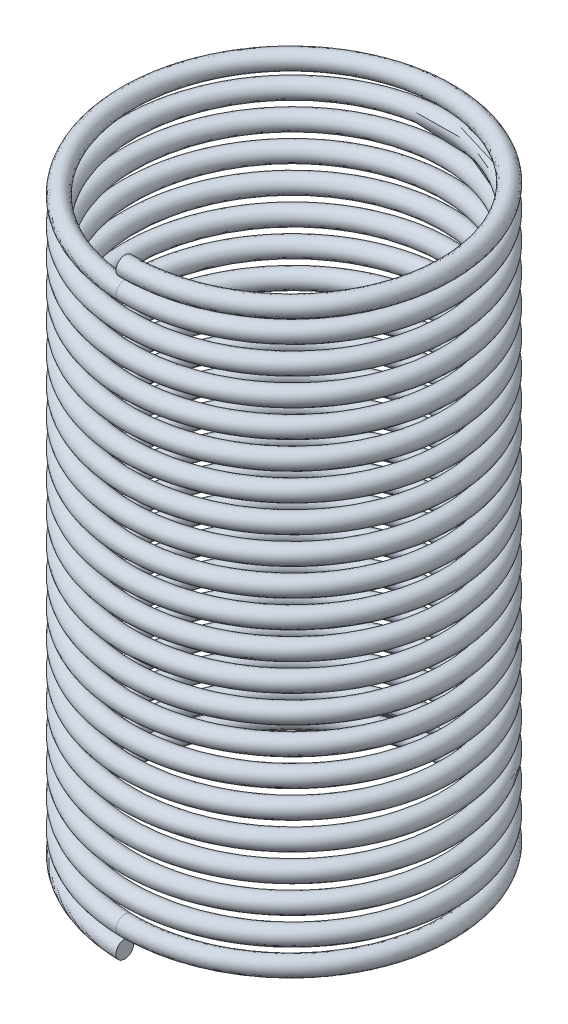
from build123d import *

# Parameters (mm, degrees)
SKETCH9_R = 0.25


with BuildPart() as part:
    # Sweep3: sweep along a curve in space
    with BuildLine() as sweep3_path:
        add(Edge.make_bspline(
            [(0, -0.6, 4.5), (-0.585272672, -0.587580128, 4.5), (-1.768623705, -0.562462812, 4.265693422), (-3.264360697, -0.525009964, 3.2648204), (-4.265816599, -0.48749733, 1.766908068), (-4.617120285, -0.450000715, 0), (-4.265702263, -0.412499808, -1.766908068), (-3.264818043, -0.375000051, -3.2648204), (-1.766908658, -0.337499987, -4.265693422), (0, -0.3, -4.617153289), (1.766908658, -0.262500013, -4.265693422), (3.264818043, -0.224999949, -3.2648204), (4.265702263, -0.187500192, -1.766908068), (4.617120285, -0.149999285, 0), (4.265816599, -0.11250267, 1.766908068), (3.264360697, -0.074990036, 3.2648204), (1.768623705, -0.037537188, 4.265693422), (0.585272672, -0.012419872, 4.5), (0, 0, 4.5)],
            knots=[0, 0, 0, 0, 0.0625, 0.125, 0.1875, 0.25, 0.3125, 0.375, 0.4375, 0.5, 0.5625, 0.625, 0.6875, 0.75, 0.8125, 0.875, 0.9375, 1, 1, 1, 1], degree=3))
        add(Edge.make_bspline(
            [(0, 0, 4.5), (-0.585273793, 0.015990616, 4.5), (-1.768623185, 0.048329115, 4.265693422), (-3.264360836, 0.096549675, 3.2648204), (-4.265816562, 0.144847187, 1.766908068), (-4.617120294, 0.193124079, 0), (-4.265702263, 0.241406497, -1.766908068), (-3.264818031, 0.289687434, -3.2648204), (-1.766908703, 0.337968768, -4.265693422), (1.7e-07, 0.386249995, -4.617153289), (1.766908023, 0.434531251, -4.265693422), (3.264820413, 0.4828125, -3.2648204), (4.265693419, 0.53109375, -1.766908068), (4.61715329, 0.579375, 0), (4.265693422, 0.62765625, 1.766908068), (3.2648204, 0.6759375, 3.2648204), (1.766908068, 0.72421875, 4.265693422), (0, 0.7725, 4.617153289), (-1.766908068, 0.82078125, 4.265693422), (-3.2648204, 0.8690625, 3.2648204), (-4.265693422, 0.91734375, 1.766908068), (-4.617153289, 0.965625, 0), (-4.265693422, 1.01390625, -1.766908068), (-3.2648204, 1.0621875, -3.2648204), (-1.766908068, 1.11046875, -4.265693422), (0, 1.15875, -4.617153289), (1.766908068, 1.20703125, -4.265693422), (3.2648204, 1.2553125, -3.2648204), (4.265693422, 1.30359375, -1.766908068), (4.617153289, 1.351875, 0), (4.265693422, 1.40015625, 1.766908068), (3.2648204, 1.4484375, 3.2648204), (1.766908068, 1.49671875, 4.265693422), (0, 1.545, 4.617153289), (-1.766908068, 1.59328125, 4.265693422), (-3.2648204, 1.6415625, 3.2648204), (-4.265693422, 1.68984375, 1.766908068), (-4.617153289, 1.738125, 0), (-4.265693422, 1.78640625, -1.766908068), (-3.2648204, 1.8346875, -3.2648204), (-1.766908068, 1.88296875, -4.265693422), (0, 1.93125, -4.617153289), (1.766908068, 1.97953125, -4.265693422), (3.2648204, 2.0278125, -3.2648204), (4.265693422, 2.07609375, -1.766908068), (4.617153289, 2.124375, 0), (4.265693422, 2.17265625, 1.766908068), (3.2648204, 2.2209375, 3.2648204), (1.766908068, 2.26921875, 4.265693422), (0, 2.3175, 4.617153289), (-1.766908068, 2.36578125, 4.265693422), (-3.2648204, 2.4140625, 3.2648204), (-4.265693422, 2.46234375, 1.766908068), (-4.617153289, 2.510625, 0), (-4.265693422, 2.55890625, -1.766908068), (-3.2648204, 2.6071875, -3.2648204), (-1.766908068, 2.65546875, -4.265693422), (0, 2.70375, -4.617153289), (1.766908068, 2.75203125, -4.265693422), (3.2648204, 2.8003125, -3.2648204), (4.265693422, 2.84859375, -1.766908068), (4.617153289, 2.896875, 0), (4.265693422, 2.94515625, 1.766908068), (3.2648204, 2.9934375, 3.2648204), (1.766908068, 3.04171875, 4.265693422), (0, 3.09, 4.617153289), (-1.766908068, 3.13828125, 4.265693422), (-3.2648204, 3.1865625, 3.2648204), (-4.265693422, 3.23484375, 1.766908068), (-4.617153289, 3.283125, 0), (-4.265693422, 3.33140625, -1.766908068), (-3.2648204, 3.3796875, -3.2648204), (-1.766908068, 3.42796875, -4.265693422), (0, 3.47625, -4.617153289), (1.766908068, 3.52453125, -4.265693422), (3.2648204, 3.5728125, -3.2648204), (4.265693422, 3.62109375, -1.766908068), (4.617153289, 3.669375, 0), (4.265693422, 3.71765625, 1.766908068), (3.2648204, 3.7659375, 3.2648204), (1.766908068, 3.81421875, 4.265693422), (0, 3.8625, 4.617153289), (-1.766908068, 3.91078125, 4.265693422), (-3.2648204, 3.9590625, 3.2648204), (-4.265693422, 4.00734375, 1.766908068), (-4.617153289, 4.055625, 0), (-4.265693422, 4.10390625, -1.766908068), (-3.2648204, 4.1521875, -3.2648204), (-1.766908068, 4.20046875, -4.265693422), (0, 4.24875, -4.617153289), (1.766908068, 4.29703125, -4.265693422), (3.2648204, 4.3453125, -3.2648204), (4.265693422, 4.39359375, -1.766908068), (4.617153289, 4.441875, 0), (4.265693422, 4.49015625, 1.766908068), (3.2648204, 4.5384375, 3.2648204), (1.766908068, 4.58671875, 4.265693422), (0, 4.635, 4.617153289), (-1.766908068, 4.68328125, 4.265693422), (-3.2648204, 4.7315625, 3.2648204), (-4.265693422, 4.77984375, 1.766908068), (-4.617153289, 4.828125, 0), (-4.265693422, 4.87640625, -1.766908068), (-3.2648204, 4.9246875, -3.2648204), (-1.766908068, 4.97296875, -4.265693422), (0, 5.02125, -4.617153289), (1.766908068, 5.06953125, -4.265693422), (3.2648204, 5.1178125, -3.2648204), (4.265693422, 5.16609375, -1.766908068), (4.617153289, 5.214375, 0), (4.265693422, 5.26265625, 1.766908068), (3.2648204, 5.3109375, 3.2648204), (1.766908068, 5.35921875, 4.265693422), (0, 5.4075, 4.617153289), (-1.766908068, 5.45578125, 4.265693422), (-3.2648204, 5.5040625, 3.2648204), (-4.265693422, 5.55234375, 1.766908068), (-4.617153289, 5.600625, 0), (-4.265693422, 5.64890625, -1.766908068), (-3.2648204, 5.6971875, -3.2648204), (-1.766908068, 5.74546875, -4.265693422), (0, 5.79375, -4.617153289), (1.766908068, 5.84203125, -4.265693422), (3.2648204, 5.8903125, -3.2648204), (4.265693422, 5.93859375, -1.766908068), (4.617153289, 5.986875, 0), (4.265693422, 6.03515625, 1.766908068), (3.2648204, 6.0834375, 3.2648204), (1.766908068, 6.13171875, 4.265693422), (0, 6.18, 4.617153289), (-1.766908068, 6.22828125, 4.265693422), (-3.2648204, 6.2765625, 3.2648204), (-4.265693422, 6.32484375, 1.766908068), (-4.617153289, 6.373125, 0), (-4.265693422, 6.42140625, -1.766908068), (-3.2648204, 6.4696875, -3.2648204), (-1.766908068, 6.51796875, -4.265693422), (0, 6.56625, -4.617153289), (1.766908068, 6.61453125, -4.265693422), (3.2648204, 6.6628125, -3.2648204), (4.265693422, 6.71109375, -1.766908068), (4.617153289, 6.759375, 0), (4.265693422, 6.80765625, 1.766908068), (3.2648204, 6.8559375, 3.2648204), (1.766908068, 6.90421875, 4.265693422), (0, 6.9525, 4.617153289), (-1.766908068, 7.00078125, 4.265693422), (-3.2648204, 7.0490625, 3.2648204), (-4.265693422, 7.09734375, 1.766908068), (-4.617153289, 7.145625, 0), (-4.265693422, 7.19390625, -1.766908068), (-3.2648204, 7.2421875, -3.2648204), (-1.766908068, 7.29046875, -4.265693422), (0, 7.33875, -4.617153289), (1.766908068, 7.38703125, -4.265693422), (3.2648204, 7.4353125, -3.2648204), (4.265693422, 7.48359375, -1.766908068), (4.617153289, 7.531875, 0), (4.265693422, 7.58015625, 1.766908068), (3.2648204, 7.6284375, 3.2648204), (1.766908068, 7.67671875, 4.265693422), (0, 7.725, 4.617153289), (-1.766908068, 7.77328125, 4.265693422), (-3.2648204, 7.8215625, 3.2648204), (-4.265693422, 7.86984375, 1.766908068), (-4.617153289, 7.918125, 0), (-4.265693422, 7.96640625, -1.766908068), (-3.2648204, 8.0146875, -3.2648204), (-1.766908068, 8.06296875, -4.265693422), (0, 8.11125, -4.617153289), (1.766908068, 8.15953125, -4.265693422), (3.2648204, 8.2078125, -3.2648204), (4.265693422, 8.25609375, -1.766908068), (4.617153289, 8.304375, 0), (4.265693422, 8.35265625, 1.766908068), (3.2648204, 8.4009375, 3.2648204), (1.766908068, 8.44921875, 4.265693422), (0, 8.4975, 4.617153289), (-1.766908068, 8.54578125, 4.265693422), (-3.2648204, 8.5940625, 3.2648204), (-4.265693422, 8.64234375, 1.766908068), (-4.617153289, 8.690625, 0), (-4.265693422, 8.73890625, -1.766908068), (-3.2648204, 8.7871875, -3.2648204), (-1.766908068, 8.83546875, -4.265693422), (0, 8.88375, -4.617153289), (1.766908068, 8.93203125, -4.265693422), (3.2648204, 8.9803125, -3.2648204), (4.265693422, 9.02859375, -1.766908068), (4.617153289, 9.076875, 0), (4.265693422, 9.12515625, 1.766908068), (3.2648204, 9.1734375, 3.2648204), (1.766908068, 9.22171875, 4.265693422), (0, 9.27, 4.617153289), (-1.766908068, 9.31828125, 4.265693422), (-3.2648204, 9.3665625, 3.2648204), (-4.265693422, 9.41484375, 1.766908068), (-4.617153289, 9.463125, 0), (-4.265693422, 9.51140625, -1.766908068), (-3.2648204, 9.5596875, -3.2648204), (-1.766908068, 9.60796875, -4.265693422), (0, 9.65625, -4.617153289), (1.766908068, 9.70453125, -4.265693422), (3.2648204, 9.7528125, -3.2648204), (4.265693422, 9.80109375, -1.766908068), (4.617153289, 9.849375, 0), (4.265693422, 9.89765625, 1.766908068), (3.2648204, 9.9459375, 3.2648204), (1.766908068, 9.99421875, 4.265693422), (0, 10.0425, 4.617153289), (-1.766908068, 10.09078125, 4.265693422), (-3.2648204, 10.1390625, 3.2648204), (-4.265693422, 10.18734375, 1.766908068), (-4.617153289, 10.235625, 0), (-4.265693422, 10.28390625, -1.766908068), (-3.2648204, 10.3321875, -3.2648204), (-1.766908068, 10.38046875, -4.265693422), (0, 10.42875, -4.617153289), (1.766908068, 10.47703125, -4.265693422), (3.2648204, 10.5253125, -3.2648204), (4.265693422, 10.57359375, -1.766908068), (4.617153289, 10.621875, 0), (4.265693422, 10.67015625, 1.766908068), (3.2648204, 10.7184375, 3.2648204), (1.766908068, 10.76671875, 4.265693422), (0, 10.815, 4.617153289), (-1.766908068, 10.86328125, 4.265693422), (-3.2648204, 10.9115625, 3.2648204), (-4.265693422, 10.95984375, 1.766908068), (-4.617153289, 11.008125, 0), (-4.265693422, 11.05640625, -1.766908068), (-3.2648204, 11.1046875, -3.2648204), (-1.766908068, 11.15296875, -4.265693422), (0, 11.20125, -4.617153289), (1.766908068, 11.24953125, -4.265693422), (3.2648204, 11.2978125, -3.2648204), (4.265693422, 11.34609375, -1.766908068), (4.617153289, 11.394375, 0), (4.265693422, 11.44265625, 1.766908068), (3.2648204, 11.4909375, 3.2648204), (1.766908068, 11.53921875, 4.265693422), (0, 11.5875, 4.617153289), (-1.766908068, 11.63578125, 4.265693422), (-3.2648204, 11.6840625, 3.2648204), (-4.265693422, 11.73234375, 1.766908068), (-4.617153289, 11.780625, 0), (-4.265693422, 11.82890625, -1.766908068), (-3.2648204, 11.8771875, -3.2648204), (-1.766908068, 11.92546875, -4.265693422), (0, 11.97375, -4.617153289), (1.766908068, 12.02203125, -4.265693422), (3.2648204, 12.0703125, -3.2648204), (4.265693422, 12.11859375, -1.766908068), (4.617153289, 12.166875, 0), (4.265693422, 12.21515625, 1.766908068), (3.2648204, 12.2634375, 3.2648204), (1.766908068, 12.31171875, 4.265693422), (0, 12.36, 4.617153289), (-1.766908068, 12.40828125, 4.265693422), (-3.2648204, 12.4565625, 3.2648204), (-4.265693422, 12.50484375, 1.766908068), (-4.617153289, 12.553125, 0), (-4.265693422, 12.60140625, -1.766908068), (-3.2648204, 12.6496875, -3.2648204), (-1.766908068, 12.69796875, -4.265693422), (0, 12.74625, -4.617153289), (1.766908068, 12.79453125, -4.265693422), (3.2648204, 12.8428125, -3.2648204), (4.265693422, 12.89109375, -1.766908068), (4.617153289, 12.939375, 0), (4.265693422, 12.98765625, 1.766908068), (3.2648204, 13.0359375, 3.2648204), (1.766908068, 13.08421875, 4.265693422), (0, 13.1325, 4.617153289), (-1.766908068, 13.18078125, 4.265693422), (-3.2648204, 13.2290625, 3.2648204), (-4.265693422, 13.27734375, 1.766908068), (-4.617153289, 13.325625, 0), (-4.265693422, 13.37390625, -1.766908068), (-3.2648204, 13.4221875, -3.2648204), (-1.766908068, 13.47046875, -4.265693422), (0, 13.51875, -4.617153289), (1.766908068, 13.56703125, -4.265693422), (3.2648204, 13.6153125, -3.2648204), (4.265693422, 13.66359375, -1.766908068), (4.617153289, 13.711875, 0), (4.265693422, 13.76015625, 1.766908068), (3.2648204, 13.8084375, 3.2648204), (1.766908068, 13.85671875, 4.265693422), (0, 13.905, 4.617153289), (-1.766908068, 13.95328125, 4.265693422), (-3.2648204, 14.0015625, 3.2648204), (-4.265693422, 14.04984375, 1.766908068), (-4.617153289, 14.098125, 0), (-4.265693422, 14.14640625, -1.766908068), (-3.2648204, 14.1946875, -3.2648204), (-1.766908068, 14.24296875, -4.265693422), (0, 14.29125, -4.617153289), (1.766908068, 14.33953125, -4.265693422), (3.2648204, 14.3878125, -3.2648204), (4.265693422, 14.43609375, -1.766908068), (4.617153289, 14.484375, 0), (4.265693422, 14.53265625, 1.766908068), (3.2648204, 14.5809375, 3.2648204), (1.766908068, 14.62921875, 4.265693422), (0, 14.6775, 4.617153289), (-1.766908068, 14.72578125, 4.265693422), (-3.2648204, 14.7740625, 3.2648204), (-4.265693422, 14.82234375, 1.766908068), (-4.61715329, 14.870625, 0), (-4.265693419, 14.91890625, -1.766908068), (-3.264820413, 14.9671875, -3.2648204), (-1.766908023, 15.015468749, -4.265693422), (-1.7e-07, 15.063750005, -4.617153289), (1.766908703, 15.112031232, -4.265693422), (3.264818031, 15.160312566, -3.2648204), (4.265702263, 15.208593503, -1.766908068), (4.617120294, 15.256875921, 0), (4.265816562, 15.305152813, 1.766908068), (3.264360836, 15.353450325, 3.2648204), (1.768623185, 15.401670885, 4.265693422), (0.585273793, 15.434009384, 4.5), (0, 15.45, 4.5)],
            knots=[0, 0, 0, 0, 0.003125, 0.00625, 0.009375, 0.0125, 0.015625, 0.01875, 0.021875, 0.025, 0.028125, 0.03125, 0.034375, 0.0375, 0.040625, 0.04375, 0.046875, 0.05, 0.053125, 0.05625, 0.059375, 0.0625, 0.065625, 0.06875, 0.071875, 0.075, 0.078125, 0.08125, 0.084375, 0.0875, 0.090625, 0.09375, 0.096875, 0.1, 0.103125, 0.10625, 0.109375, 0.1125, 0.115625, 0.11875, 0.121875, 0.125, 0.128125, 0.13125, 0.134375, 0.1375, 0.140625, 0.14375, 0.146875, 0.15, 0.153125, 0.15625, 0.159375, 0.1625, 0.165625, 0.16875, 0.171875, 0.175, 0.178125, 0.18125, 0.184375, 0.1875, 0.190625, 0.19375, 0.196875, 0.2, 0.203125, 0.20625, 0.209375, 0.2125, 0.215625, 0.21875, 0.221875, 0.225, 0.228125, 0.23125, 0.234375, 0.2375, 0.240625, 0.24375, 0.246875, 0.25, 0.253125, 0.25625, 0.259375, 0.2625, 0.265625, 0.26875, 0.271875, 0.275, 0.278125, 0.28125, 0.284375, 0.2875, 0.290625, 0.29375, 0.296875, 0.3, 0.303125, 0.30625, 0.309375, 0.3125, 0.315625, 0.31875, 0.321875, 0.325, 0.328125, 0.33125, 0.334375, 0.3375, 0.340625, 0.34375, 0.346875, 0.35, 0.353125, 0.35625, 0.359375, 0.3625, 0.365625, 0.36875, 0.371875, 0.375, 0.378125, 0.38125, 0.384375, 0.3875, 0.390625, 0.39375, 0.396875, 0.4, 0.403125, 0.40625, 0.409375, 0.4125, 0.415625, 0.41875, 0.421875, 0.425, 0.428125, 0.43125, 0.434375, 0.4375, 0.440625, 0.44375, 0.446875, 0.45, 0.453125, 0.45625, 0.459375, 0.4625, 0.465625, 0.46875, 0.471875, 0.475, 0.478125, 0.48125, 0.484375, 0.4875, 0.490625, 0.49375, 0.496875, 0.5, 0.503125, 0.50625, 0.509375, 0.5125, 0.515625, 0.51875, 0.521875, 0.525, 0.528125, 0.53125, 0.534375, 0.5375, 0.540625, 0.54375, 0.546875, 0.55, 0.553125, 0.55625, 0.559375, 0.5625, 0.565625, 0.56875, 0.571875, 0.575, 0.578125, 0.58125, 0.584375, 0.5875, 0.590625, 0.59375, 0.596875, 0.6, 0.603125, 0.60625, 0.609375, 0.6125, 0.615625, 0.61875, 0.621875, 0.625, 0.628125, 0.63125, 0.634375, 0.6375, 0.640625, 0.64375, 0.646875, 0.65, 0.653125, 0.65625, 0.659375, 0.6625, 0.665625, 0.66875, 0.671875, 0.675, 0.678125, 0.68125, 0.684375, 0.6875, 0.690625, 0.69375, 0.696875, 0.7, 0.703125, 0.70625, 0.709375, 0.7125, 0.715625, 0.71875, 0.721875, 0.725, 0.728125, 0.73125, 0.734375, 0.7375, 0.740625, 0.74375, 0.746875, 0.75, 0.753125, 0.75625, 0.759375, 0.7625, 0.765625, 0.76875, 0.771875, 0.775, 0.778125, 0.78125, 0.784375, 0.7875, 0.790625, 0.79375, 0.796875, 0.8, 0.803125, 0.80625, 0.809375, 0.8125, 0.815625, 0.81875, 0.821875, 0.825, 0.828125, 0.83125, 0.834375, 0.8375, 0.840625, 0.84375, 0.846875, 0.85, 0.853125, 0.85625, 0.859375, 0.8625, 0.865625, 0.86875, 0.871875, 0.875, 0.878125, 0.88125, 0.884375, 0.8875, 0.890625, 0.89375, 0.896875, 0.9, 0.903125, 0.90625, 0.909375, 0.9125, 0.915625, 0.91875, 0.921875, 0.925, 0.928125, 0.93125, 0.934375, 0.9375, 0.940625, 0.94375, 0.946875, 0.95, 0.953125, 0.95625, 0.959375, 0.9625, 0.965625, 0.96875, 0.971875, 0.975, 0.978125, 0.98125, 0.984375, 0.9875, 0.990625, 0.99375, 0.996875, 1, 1, 1, 1], degree=3))
        add(Edge.make_bspline(
            [(0, 15.45, 4.5), (-0.585272672, 15.462419872, 4.5), (-1.768623705, 15.487537188, 4.265693422), (-3.264360697, 15.524990036, 3.2648204), (-4.265816599, 15.56250267, 1.766908068), (-4.617120285, 15.599999285, 0), (-4.265702263, 15.637500192, -1.766908068), (-3.264818043, 15.674999949, -3.2648204), (-1.766908658, 15.712500013, -4.265693422), (0, 15.75, -4.617153289), (1.766908658, 15.787499987, -4.265693422), (3.264818043, 15.825000051, -3.2648204), (4.265702263, 15.862499808, -1.766908068), (4.617120285, 15.900000715, 0), (4.265816599, 15.93749733, 1.766908068), (3.264360697, 15.975009964, 3.2648204), (1.768623705, 16.012462812, 4.265693422), (0.585272672, 16.037580128, 4.5), (0, 16.05, 4.5)],
            knots=[0, 0, 0, 0, 0.0625, 0.125, 0.1875, 0.25, 0.3125, 0.375, 0.4375, 0.5, 0.5625, 0.625, 0.6875, 0.75, 0.8125, 0.875, 0.9375, 1, 1, 1, 1], degree=3))
    # Sketch9 → Sweep3 (sweep)
    with BuildSketch(Plane(origin=(0, -0.6, 4.5), x_dir=(0, 0, -1), z_dir=(0.9997749178299158, -0.021215882686923065, -1.3334807804178297e-14))):
        with Locations((0.023180512, 0.035307657)):
            Circle(SKETCH9_R)
    sweep(path=sweep3_path.line, is_frenet=True, transition=Transition.RIGHT)


solid = part.part
